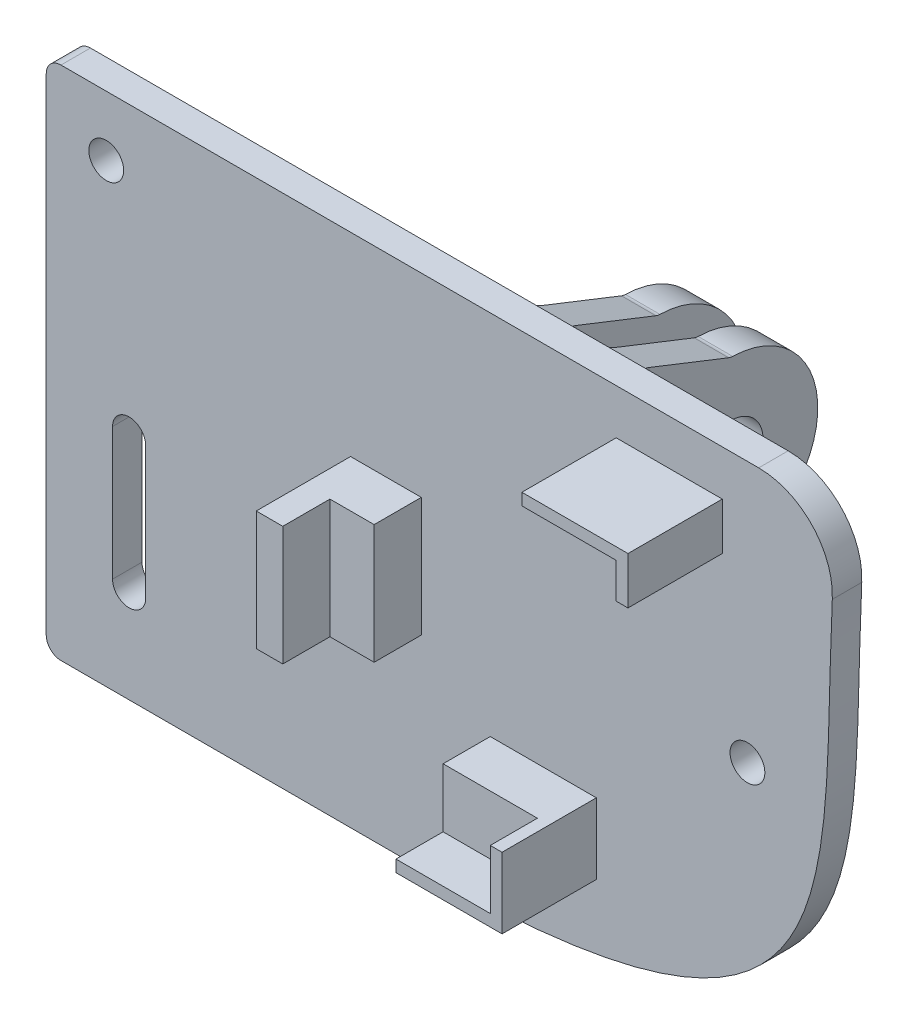
from build123d import *

# Parameters (mm, degrees)
BOSS_EXTRUDE1_DEPTH = 2.54
SKETCH8_R           = 2.794
BOSS_EXTRUDE5_DEPTH = 1.4859
SKETCH9_R           = 2.794
BOSS_EXTRUDE6_DEPTH = 1.4859
FILLET1_R           = 6.35
FILLET2_R           = 1.27
SKETCH11_R          = 1.5
CUT_EXTRUDE1_DEPTH  = 104.464232939
CUT_EXTRUDE3_DEPTH  = 104.464232939
SKETCH14_W          = 9.144
SKETCH14_H          = 6.096
SKETCH14_W_2        = 6.096
SKETCH14_H_2        = 10.277436068
SKETCH14_H_3        = 4.064
BOSS_EXTRUDE7_DEPTH = 4.064
SKETCH15_W          = 2.286
SKETCH15_H          = 10.277436068
BOSS_EXTRUDE8_DEPTH = 4.064
FILLET3_R           = 1


with BuildPart() as part:
    # Sketch3 → Boss-Extrude1 (new body)
    with BuildSketch(Plane(origin=(0, 0, 48.176932074), x_dir=(-1, 0, 0), z_dir=(0, 0, -1))):
        with BuildLine():
            Line((-5.330605085, -70.964477634), (-5.330605085, -26.514477634))
            Line((-5.330605085, -26.514477634), (-73.555005085, -26.514477634))
            add(Edge.make_bspline(
                [(-37.080605085, -70.964477634), (-79.637463047, -70.964477634), (-70.893021391, -52.676234808), (-73.555005085, -26.514477634)],
                knots=[0, 0, 0, 0, 1, 1, 1, 1], degree=3))
            Line((-37.080605085, -70.964477634), (-5.330605085, -70.964477634))
        make_face()
    extrude(amount=BOSS_EXTRUDE1_DEPTH)

    # Sketch8 → Boss-Extrude5 (add, symmetric)
    with BuildSketch(Plane.ZY.offset(-45.970605085)):
        with BuildLine():
            Line((45.636932074, -45.088449611), (45.636932074, -30.077049611))
            Line((45.636932074, -30.077049611), (45.636932074, -26.902049611))
            Line((45.636932074, -26.902049611), (37.585132074, -30.077049611))
            ThreePointArc((37.585132074, -30.077049611), (30.079432074, -37.582749611), (37.585132074, -45.088449611))
            Line((37.585132074, -45.088449611), (45.636932074, -48.263449611))
            Line((45.636932074, -48.263449611), (45.636932074, -45.088449611))
        make_face()
        with Locations((37.585132074, -37.582749611)):
            Circle(SKETCH8_R, mode=Mode.SUBTRACT)
    extrude(amount=BOSS_EXTRUDE5_DEPTH, both=True)

    # Sketch9 → Boss-Extrude6 (add, symmetric)
    with BuildSketch(Plane.ZY.offset(-52.244405085)):
        with BuildLine():
            Line((37.585132074, -30.077049611), (45.636932074, -26.902049611))
            Line((45.636932074, -26.902049611), (45.636932074, -30.077049611))
            Line((45.636932074, -30.077049611), (45.636932074, -45.088449611))
            Line((45.636932074, -45.088449611), (45.636932074, -48.263449611))
            Line((45.636932074, -48.263449611), (37.585132074, -45.088449611))
            ThreePointArc((37.585132074, -45.088449611), (30.079432074, -37.582749611), (37.585132074, -30.077049611))
        make_face()
        with Locations((37.585132074, -37.582749611)):
            Circle(SKETCH9_R, mode=Mode.SUBTRACT)
    extrude(amount=BOSS_EXTRUDE6_DEPTH, both=True)

    # Fillet1
    fillet1_edges = [part.edges().sort_by_distance(p)[0] for p in [
        (73.555005085, -26.514477634, 46.906932074),
    ]]
    fillet(fillet1_edges, radius=FILLET1_R)

    # Fillet2
    fillet2_edges = [part.edges().sort_by_distance(p)[0] for p in [
        (5.330605085, -26.514477634, 46.906932074),
        (5.330605085, -70.964477634, 46.906932074),
    ]]
    fillet(fillet2_edges, radius=FILLET2_R)

    # Sketch11 → Cut-Extrude1 (cut, through all)
    with BuildSketch(Plane.XY.offset(48.176932074)):
        with Locations((10.501991532, -31.685864082)):
            Circle(SKETCH11_R)
        with Locations((65.764167989, -49.003253007)):
            Circle(SKETCH11_R)
    extrude(amount=-CUT_EXTRUDE1_DEPTH, mode=Mode.SUBTRACT)

    # Sketch13 → Cut-Extrude3 (cut, through all)
    with BuildSketch(Plane.XY.offset(48.176932074)):
        with BuildLine():
            Line((11.045605085, -62.666787944), (11.045605085, -51.271162116))
            ThreePointArc((11.045605085, -51.271162116), (12.473581383, -49.843185817), (13.901557682, -51.271162116))
            Line((13.901557682, -51.271162116), (13.901557682, -62.666787944))
            ThreePointArc((13.901557682, -62.666787944), (12.473581383, -64.094764243), (11.045605085, -62.666787944))
        make_face()
    extrude(amount=-CUT_EXTRUDE3_DEPTH, mode=Mode.SUBTRACT)

    # Sketch14 → Boss-Extrude7 (add)
    with BuildSketch(Plane.XY.offset(48.176932074)):
        with Locations((48.170658264, -61.185477634)):
            Rectangle(SKETCH14_W, SKETCH14_H)
        with Locations((34.607686971, -48.396046186)):
            Rectangle(SKETCH14_W_2, SKETCH14_H_2)
        with Locations((59.024762651, -32.446016036)):
            Rectangle(SKETCH14_W, SKETCH14_H_3)
    extrude(amount=BOSS_EXTRUDE7_DEPTH)

    # Sketch15 → Boss-Extrude8 (add)
    with BuildSketch(Plane.XY.offset(52.240932074)):
        with Locations((32.702686971, -48.396046186)):
            Rectangle(SKETCH15_W, SKETCH15_H)
        Polygon((54.452762651, -30.414016036), (54.452762651, -31.430016036), (62.580762651, -31.430016036), (62.580762651, -34.478016036), (63.596762651, -34.478016036), (63.596762651, -30.414016036), align=None)
        Polygon((43.598658264, -63.217477634), (51.726658264, -63.217477634), (51.726658264, -58.137477634), (52.742658264, -58.137477634), (52.742658264, -64.233477634), (43.598658264, -64.233477634), align=None)
    extrude(amount=BOSS_EXTRUDE8_DEPTH)

    # Fillet3
    # the kernel refuses this fillet: 1 mm, written as the material it adds along each edge
    with BuildSketch(Plane(origin=(44.484705085, -24.402049611, 45.636932074), x_dir=(-1, 0, 0), z_dir=(0, -1, 0))) as fillet3_piece_1_section:
        with BuildLine():
            CenterArc((FILLET3_R, FILLET3_R), FILLET3_R, 180, 90)
            Line((0, FILLET3_R), (-FILLET3_R * 0.02, FILLET3_R))
            Line((-FILLET3_R * 0.02, FILLET3_R), (-FILLET3_R * 0.02, -FILLET3_R * 0.02))
            Line((-FILLET3_R * 0.02, -FILLET3_R * 0.02), (FILLET3_R, -FILLET3_R * 0.02))
            Line((FILLET3_R, -FILLET3_R * 0.02), (FILLET3_R, 0))
        make_face()
    fillet3_piece_1 = extrude(amount=26.3614, mode=Mode.PRIVATE)
    fillet3_piece_1 = split(fillet3_piece_1, bisect_by=Plane(origin=(44.257287749, -28.415977986, 41.797609716), z_dir=(0, -0.9302870363838799, 0.36683242759616796)), keep=Keep.TOP, mode=Mode.PRIVATE)
    fillet3_piece_1 = split(fillet3_piece_1, bisect_by=Plane(origin=(44.257287749, -46.749521237, 41.797609716), z_dir=(0, 0.9302870363838802, 0.36683242759616724)), keep=Keep.TOP, mode=Mode.PRIVATE)
    add(fillet3_piece_1)
    with BuildSketch(Plane(origin=(47.456505085, -30.077049611, 37.585132074), x_dir=(0, -0.011507965676518926, -0.9999337811705274), z_dir=(-1, 0, 0)), Plane(origin=(44.484705085, -45.088449611, 37.585132074), x_dir=(0, 0.011507965676519873, -0.9999337811705273), z_dir=(1, 0, 0)), Plane(origin=(53.730305085, -30.077049611, 37.585132074), x_dir=(0, -0.011507965676498363, -0.9999337811705276), z_dir=(-1, 0, 0))) as fillet3_piece_2:
        with BuildLine():
            CenterArc((0.184258642, -0.999933781), FILLET3_R, 90.659372418, 20.20165218)
            Line((-0.171843783, -0.065486852), (-0.178965832, -0.046797914))
            Line((-0.178965832, -0.046797914), (-0.007122049, 0.018688939))
            Line((-0.007122049, 0.018688939), (0.000230159, 0.019998676))
            ThreePointArc((0.000230159, 0.019998676), (0.086375338, 0.019502981), (0.172520517, 0.019998676))
            Line((0.172520517, 0.019998676), (0.172750676, 0))
        make_face()
    extrude(amount=2.9718)
    with BuildSketch(Plane(origin=(47.456505085, -50.763449611, 45.636932074), x_dir=(1, 0, 0), z_dir=(0, 1, 0))) as fillet3_piece_3_section:
        with BuildLine():
            CenterArc((FILLET3_R, FILLET3_R), FILLET3_R, 180, 90)
            Line((0, FILLET3_R), (-FILLET3_R * 0.02, FILLET3_R))
            Line((-FILLET3_R * 0.02, FILLET3_R), (-FILLET3_R * 0.02, -FILLET3_R * 0.02))
            Line((-FILLET3_R * 0.02, -FILLET3_R * 0.02), (FILLET3_R, -FILLET3_R * 0.02))
            Line((FILLET3_R, -FILLET3_R * 0.02), (FILLET3_R, 0))
        make_face()
    fillet3_piece_3 = extrude(amount=26.3614, mode=Mode.PRIVATE)
    fillet3_piece_3 = split(fillet3_piece_3, bisect_by=Plane(origin=(47.68392242, -28.415977986, 41.797609716), z_dir=(0, -0.9302870363838799, 0.36683242759616796)), keep=Keep.TOP, mode=Mode.PRIVATE)
    fillet3_piece_3 = split(fillet3_piece_3, bisect_by=Plane(origin=(47.68392242, -46.749521237, 41.797609716), z_dir=(0, 0.9302870363838802, 0.36683242759616724)), keep=Keep.TOP, mode=Mode.PRIVATE)
    add(fillet3_piece_3)
    with BuildSketch(Plane(origin=(44.484705085, -48.263449611, 45.636932074), x_dir=(0, -1, 0), z_dir=(1, 0, 0)), Plane(origin=(50.758505085, -48.263449611, 45.636932074), x_dir=(0, -1, 0), z_dir=(1, 0, 0))) as fillet3_piece_4:
        with BuildLine():
            CenterArc((FILLET3_R * 0.680615280704, FILLET3_R), FILLET3_R, 201.520397017, 68.479602983)
            Line((-FILLET3_R * 0.24967175568, FILLET3_R * 0.633167572404), (-FILLET3_R * 0.268277496407, FILLET3_R * 0.625830923852))
            Line((-FILLET3_R * 0.268277496407, FILLET3_R * 0.625830923852), (-FILLET3_R * 0.0136123056141, -FILLET3_R * 0.02))
            Line((-FILLET3_R * 0.0136123056141, -FILLET3_R * 0.02), (FILLET3_R * 0.680615280704, -FILLET3_R * 0.02))
            Line((FILLET3_R * 0.680615280704, -FILLET3_R * 0.02), (FILLET3_R * 0.680615280704, 0))
        make_face()
    extrude(amount=2.9718)
    with BuildSketch(Plane(origin=(47.456505085, -26.902049611, 45.636932074), x_dir=(0, 1, 0), z_dir=(-1, 0, 0))) as fillet3_piece_5:
        with BuildLine():
            CenterArc((0.700407326, 0.949807372), FILLET3_R, 201.520397017, 50.249417843)
            Line((-0.22987971, 0.582974945), (-0.248485451, 0.575638296))
            Line((-0.248485451, 0.575638296), (-0.018605741, -0.007336649))
            Line((-0.018605741, -0.007336649), (0, -0.02))
            ThreePointArc((0, -0.02), (0.193785989, -0.02), (0.38131527, -0.018996147))
            Line((0.38131527, -0.018996147), (0.387571977, 0))
        make_face()
    extrude(amount=2.9718)
    with BuildSketch(Plane(origin=(50.758505085, -24.402049611, 45.636932074), x_dir=(-1, 0, 0), z_dir=(0, -1, 0))) as fillet3_piece_6_section:
        with BuildLine():
            CenterArc((FILLET3_R, FILLET3_R), FILLET3_R, 180, 90)
            Line((0, FILLET3_R), (-FILLET3_R * 0.02, FILLET3_R))
            Line((-FILLET3_R * 0.02, FILLET3_R), (-FILLET3_R * 0.02, -FILLET3_R * 0.02))
            Line((-FILLET3_R * 0.02, -FILLET3_R * 0.02), (FILLET3_R, -FILLET3_R * 0.02))
            Line((FILLET3_R, -FILLET3_R * 0.02), (FILLET3_R, 0))
        make_face()
    fillet3_piece_6 = extrude(amount=26.3614, mode=Mode.PRIVATE)
    fillet3_piece_6 = split(fillet3_piece_6, bisect_by=Plane(origin=(50.531087749, -46.749521237, 41.797609716), z_dir=(0, 0.9302870363838802, 0.36683242759616724)), keep=Keep.TOP, mode=Mode.PRIVATE)
    fillet3_piece_6 = split(fillet3_piece_6, bisect_by=Plane(origin=(50.531087749, -28.415977986, 41.797609716), z_dir=(0, -0.9302870363838799, 0.36683242759616835)), keep=Keep.TOP, mode=Mode.PRIVATE)
    add(fillet3_piece_6)
    with BuildSketch(Plane(origin=(50.758505085, -26.902049611, 45.636932074), x_dir=(0, 1, 0), z_dir=(1, 0, 0))) as fillet3_piece_7:
        with BuildLine():
            CenterArc((0.700407326, -0.949807372), FILLET3_R, 108.23018514, 50.249417843)
            Line((-0.22987971, -0.582974945), (-0.248485451, -0.575638296))
            Line((-0.248485451, -0.575638296), (-0.018605741, 0.007336649))
            Line((-0.018605741, 0.007336649), (0, 0.02))
            ThreePointArc((0, 0.02), (0.193785989, 0.02), (0.38131527, 0.018996147))
            Line((0.38131527, 0.018996147), (0.387571977, 0))
        make_face()
    extrude(amount=2.9718)
    with BuildSketch(Plane(origin=(53.730305085, -45.088449611, 37.585132074), x_dir=(0, -0.3668324275961554, 0.9302870363838848), z_dir=(-1, 0, 0))) as fillet3_piece_8:
        with BuildLine():
            CenterArc((0.183898923, -1), FILLET3_R, 90, 20.20165218)
            Line((-0.161426339, -0.061516935), (-0.168332844, -0.042747273))
            ThreePointArc((-0.168332844, -0.042747273), (-0.087658228, -0.012533966), (-0.007336649, 0.018605741))
            Line((-0.007336649, 0.018605741), (0, 0.02))
            Line((0, 0.02), (0.183898923, 0.02))
            Line((0.183898923, 0.02), (0.183898923, 0))
        make_face()
    extrude(amount=2.9718)
    with BuildSketch(Plane(origin=(53.730305085, -50.763449611, 45.636932074), x_dir=(1, 0, 0), z_dir=(0, 1, 0))) as fillet3_piece_9_section:
        with BuildLine():
            CenterArc((FILLET3_R, FILLET3_R), FILLET3_R, 180, 90)
            Line((0, FILLET3_R), (-FILLET3_R * 0.02, FILLET3_R))
            Line((-FILLET3_R * 0.02, FILLET3_R), (-FILLET3_R * 0.02, -FILLET3_R * 0.02))
            Line((-FILLET3_R * 0.02, -FILLET3_R * 0.02), (FILLET3_R, -FILLET3_R * 0.02))
            Line((FILLET3_R, -FILLET3_R * 0.02), (FILLET3_R, 0))
        make_face()
    fillet3_piece_9 = extrude(amount=26.3614, mode=Mode.PRIVATE)
    fillet3_piece_9 = split(fillet3_piece_9, bisect_by=Plane(origin=(53.95772242, -46.749521237, 41.797609716), z_dir=(0, 0.9302870363838802, 0.36683242759616724)), keep=Keep.TOP, mode=Mode.PRIVATE)
    fillet3_piece_9 = split(fillet3_piece_9, bisect_by=Plane(origin=(53.95772242, -28.415977986, 41.797609716), z_dir=(0, -0.9302870363838799, 0.36683242759616835)), keep=Keep.TOP, mode=Mode.PRIVATE)
    add(fillet3_piece_9)
    with BuildSketch(Plane(origin=(47.456505085, -26.902049611, 45.636932074), x_dir=(0, 1, 0), z_dir=(-1, 0, 0))) as fillet3_piece_10a_section:
        with BuildLine():
            CenterArc((0.700407326, 0.949807372), FILLET3_R, 201.520397017, 50.249417843)
            Line((-0.22987971, 0.582974945), (-0.248485451, 0.575638296))
            Line((-0.248485451, 0.575638296), (-0.018605741, -0.007336649))
            Line((-0.018605741, -0.007336649), (0, -0.02))
            ThreePointArc((0, -0.02), (0.193785989, -0.02), (0.38131527, -0.018996147))
            Line((0.38131527, -0.018996147), (0.387571977, 0))
        make_face()
    fillet3_piece_10a = extrude(amount=4.538453414, mode=Mode.PRIVATE)
    fillet3_piece_10a = split(fillet3_piece_10a, bisect_by=Plane(origin=(44.484705085, -26.864445024, 45.495418853), z_dir=(-1, 0, 0)), keep=Keep.TOP, mode=Mode.PRIVATE)
    with BuildSketch(Plane(origin=(44.484705085, -24.402049611, 45.636932074), x_dir=(-1, 0, 0), z_dir=(0, -1, 0))) as fillet3_piece_10b_section:
        with BuildLine():
            CenterArc((FILLET3_R, FILLET3_R), FILLET3_R, 180, 90)
            Line((0, FILLET3_R), (-FILLET3_R * 0.02, FILLET3_R))
            Line((-FILLET3_R * 0.02, FILLET3_R), (-FILLET3_R * 0.02, -FILLET3_R * 0.02))
            Line((-FILLET3_R * 0.02, -FILLET3_R * 0.02), (FILLET3_R, -FILLET3_R * 0.02))
            Line((FILLET3_R, -FILLET3_R * 0.02), (FILLET3_R, 0))
        make_face()
    fillet3_piece_10b = extrude(amount=26.3614, mode=Mode.PRIVATE)
    fillet3_piece_10b = split(fillet3_piece_10b, bisect_by=Plane(origin=(44.281015021, -26.514477634, 45.372103573), z_dir=(0, -1, 0)), keep=Keep.TOP, mode=Mode.PRIVATE)
    fillet3_piece_10b = split(fillet3_piece_10b, bisect_by=Plane(origin=(44.281015021, -26.973374036, 45.456053333), z_dir=(0, 0.9302870363838799, -0.36683242759616796)), keep=Keep.TOP, mode=Mode.PRIVATE)
    fillet3_piece_10 = fillet3_piece_10a & fillet3_piece_10b
    add(fillet3_piece_10)
    with BuildSketch(Plane(origin=(42.783166883, -48.263449611, 45.636932074), x_dir=(0, -1, 0), z_dir=(1, 0, 0))) as fillet3_piece_11a_section:
        with BuildLine():
            CenterArc((FILLET3_R * 0.680615280704, FILLET3_R), FILLET3_R, 201.520397017, 68.479602983)
            Line((-FILLET3_R * 0.24967175568, FILLET3_R * 0.633167572404), (-FILLET3_R * 0.268277496407, FILLET3_R * 0.625830923852))
            Line((-FILLET3_R * 0.268277496407, FILLET3_R * 0.625830923852), (-FILLET3_R * 0.0136123056141, -FILLET3_R * 0.02))
            Line((-FILLET3_R * 0.0136123056141, -FILLET3_R * 0.02), (FILLET3_R * 0.680615280704, -FILLET3_R * 0.02))
            Line((FILLET3_R * 0.680615280704, -FILLET3_R * 0.02), (FILLET3_R * 0.680615280704, 0))
        make_face()
    fillet3_piece_11a = extrude(amount=4.673338202, mode=Mode.PRIVATE)
    fillet3_piece_11a = split(fillet3_piece_11a, bisect_by=Plane(origin=(44.484705085, -48.357764725, 45.498358762), z_dir=(-1, 0, 0)), keep=Keep.TOP, mode=Mode.PRIVATE)
    with BuildSketch(Plane(origin=(44.484705085, -24.402049611, 45.636932074), x_dir=(-1, 0, 0), z_dir=(0, -1, 0))) as fillet3_piece_11b_section:
        with BuildLine():
            CenterArc((FILLET3_R, FILLET3_R), FILLET3_R, 180, 90)
            Line((0, FILLET3_R), (-FILLET3_R * 0.02, FILLET3_R))
            Line((-FILLET3_R * 0.02, FILLET3_R), (-FILLET3_R * 0.02, -FILLET3_R * 0.02))
            Line((-FILLET3_R * 0.02, -FILLET3_R * 0.02), (FILLET3_R, -FILLET3_R * 0.02))
            Line((FILLET3_R, -FILLET3_R * 0.02), (FILLET3_R, 0))
        make_face()
    fillet3_piece_11b = extrude(amount=26.3614, mode=Mode.PRIVATE)
    fillet3_piece_11b = split(fillet3_piece_11b, bisect_by=Plane(origin=(44.262491368, -48.345787947, 45.845742093), z_dir=(0, -0.9302870363838802, -0.36683242759616724)), keep=Keep.TOP, mode=Mode.PRIVATE)
    fillet3_piece_11 = fillet3_piece_11a & fillet3_piece_11b
    add(fillet3_piece_11)
    with BuildSketch(Plane(origin=(47.456505085, -50.763449611, 45.636932074), x_dir=(1, 0, 0), z_dir=(0, 1, 0))) as fillet3_piece_12a_section:
        with BuildLine():
            CenterArc((FILLET3_R, FILLET3_R), FILLET3_R, 180, 90)
            Line((0, FILLET3_R), (-FILLET3_R * 0.02, FILLET3_R))
            Line((-FILLET3_R * 0.02, FILLET3_R), (-FILLET3_R * 0.02, -FILLET3_R * 0.02))
            Line((-FILLET3_R * 0.02, -FILLET3_R * 0.02), (FILLET3_R, -FILLET3_R * 0.02))
            Line((FILLET3_R, -FILLET3_R * 0.02), (FILLET3_R, 0))
        make_face()
    fillet3_piece_12a = extrude(amount=26.3614, mode=Mode.PRIVATE)
    fillet3_piece_12a = split(fillet3_piece_12a, bisect_by=Plane(origin=(47.678718801, -48.345787947, 45.845742093), z_dir=(0, -0.9302870363838802, -0.36683242759616724)), keep=Keep.TOP, mode=Mode.PRIVATE)
    with BuildSketch(Plane(origin=(44.484705085, -48.263449611, 45.636932074), x_dir=(0, -1, 0), z_dir=(1, 0, 0))) as fillet3_piece_12b_section:
        with BuildLine():
            CenterArc((FILLET3_R * 0.680615280704, FILLET3_R), FILLET3_R, 201.520397017, 68.479602983)
            Line((-FILLET3_R * 0.24967175568, FILLET3_R * 0.633167572404), (-FILLET3_R * 0.268277496407, FILLET3_R * 0.625830923852))
            Line((-FILLET3_R * 0.268277496407, FILLET3_R * 0.625830923852), (-FILLET3_R * 0.0136123056141, -FILLET3_R * 0.02))
            Line((-FILLET3_R * 0.0136123056141, -FILLET3_R * 0.02), (FILLET3_R * 0.680615280704, -FILLET3_R * 0.02))
            Line((FILLET3_R * 0.680615280704, -FILLET3_R * 0.02), (FILLET3_R * 0.680615280704, 0))
        make_face()
    fillet3_piece_12b = extrude(amount=4.673338202, mode=Mode.PRIVATE)
    fillet3_piece_12b = split(fillet3_piece_12b, bisect_by=Plane(origin=(47.456505085, -48.357764725, 45.498358762), z_dir=(1, 0, 0)), keep=Keep.TOP, mode=Mode.PRIVATE)
    fillet3_piece_12 = fillet3_piece_12a & fillet3_piece_12b
    add(fillet3_piece_12)
    with BuildSketch(Plane(origin=(47.456505085, -50.763449611, 45.636932074), x_dir=(1, 0, 0), z_dir=(0, 1, 0))) as fillet3_piece_13a_section:
        with BuildLine():
            CenterArc((FILLET3_R, FILLET3_R), FILLET3_R, 180, 90)
            Line((0, FILLET3_R), (-FILLET3_R * 0.02, FILLET3_R))
            Line((-FILLET3_R * 0.02, FILLET3_R), (-FILLET3_R * 0.02, -FILLET3_R * 0.02))
            Line((-FILLET3_R * 0.02, -FILLET3_R * 0.02), (FILLET3_R, -FILLET3_R * 0.02))
            Line((FILLET3_R, -FILLET3_R * 0.02), (FILLET3_R, 0))
        make_face()
    fillet3_piece_13a = extrude(amount=26.3614, mode=Mode.PRIVATE)
    fillet3_piece_13a = split(fillet3_piece_13a, bisect_by=Plane(origin=(47.660195148, -26.514477634, 45.372103573), z_dir=(0, -1, 0)), keep=Keep.TOP, mode=Mode.PRIVATE)
    fillet3_piece_13a = split(fillet3_piece_13a, bisect_by=Plane(origin=(47.660195148, -26.973374036, 45.456053333), z_dir=(0, 0.9302870363838799, -0.36683242759616796)), keep=Keep.TOP, mode=Mode.PRIVATE)
    with BuildSketch(Plane(origin=(49.023158499, -26.902049611, 45.636932074), x_dir=(0, 1, 0), z_dir=(-1, 0, 0))) as fillet3_piece_13b_section:
        with BuildLine():
            CenterArc((0.700407326, 0.949807372), FILLET3_R, 201.520397017, 50.249417843)
            Line((-0.22987971, 0.582974945), (-0.248485451, 0.575638296))
            Line((-0.248485451, 0.575638296), (-0.018605741, -0.007336649))
            Line((-0.018605741, -0.007336649), (0, -0.02))
            ThreePointArc((0, -0.02), (0.193785989, -0.02), (0.38131527, -0.018996147))
            Line((0.38131527, -0.018996147), (0.387571977, 0))
        make_face()
    fillet3_piece_13b = extrude(amount=4.538453414, mode=Mode.PRIVATE)
    fillet3_piece_13b = split(fillet3_piece_13b, bisect_by=Plane(origin=(47.456505085, -26.864445024, 45.495418853), z_dir=(1, 0, 0)), keep=Keep.TOP, mode=Mode.PRIVATE)
    fillet3_piece_13 = fillet3_piece_13a & fillet3_piece_13b
    add(fillet3_piece_13)
    with BuildSketch(Plane(origin=(49.19185167, -26.902049611, 45.636932074), x_dir=(0, 1, 0), z_dir=(1, 0, 0))) as fillet3_piece_14a_section:
        with BuildLine():
            CenterArc((0.700407326, -0.949807372), FILLET3_R, 108.23018514, 50.249417843)
            Line((-0.22987971, -0.582974945), (-0.248485451, -0.575638296))
            Line((-0.248485451, -0.575638296), (-0.018605741, 0.007336649))
            Line((-0.018605741, 0.007336649), (0, 0.02))
            ThreePointArc((0, 0.02), (0.193785989, 0.02), (0.38131527, 0.018996147))
            Line((0.38131527, 0.018996147), (0.387571977, 0))
        make_face()
    fillet3_piece_14a = extrude(amount=4.538453414, mode=Mode.PRIVATE)
    fillet3_piece_14a = split(fillet3_piece_14a, bisect_by=Plane(origin=(50.758505085, -26.864445024, 45.495418853), z_dir=(-1, 0, 0)), keep=Keep.TOP, mode=Mode.PRIVATE)
    with BuildSketch(Plane(origin=(50.758505085, -24.402049611, 45.636932074), x_dir=(-1, 0, 0), z_dir=(0, -1, 0))) as fillet3_piece_14b_section:
        with BuildLine():
            CenterArc((FILLET3_R, FILLET3_R), FILLET3_R, 180, 90)
            Line((0, FILLET3_R), (-FILLET3_R * 0.02, FILLET3_R))
            Line((-FILLET3_R * 0.02, FILLET3_R), (-FILLET3_R * 0.02, -FILLET3_R * 0.02))
            Line((-FILLET3_R * 0.02, -FILLET3_R * 0.02), (FILLET3_R, -FILLET3_R * 0.02))
            Line((FILLET3_R, -FILLET3_R * 0.02), (FILLET3_R, 0))
        make_face()
    fillet3_piece_14b = extrude(amount=26.3614, mode=Mode.PRIVATE)
    fillet3_piece_14b = split(fillet3_piece_14b, bisect_by=Plane(origin=(50.554815021, -26.514477634, 45.372103573), z_dir=(0, -1, 0)), keep=Keep.TOP, mode=Mode.PRIVATE)
    fillet3_piece_14b = split(fillet3_piece_14b, bisect_by=Plane(origin=(50.554815021, -26.973374036, 45.456053333), z_dir=(0, 0.9302870363838799, -0.36683242759616835)), keep=Keep.TOP, mode=Mode.PRIVATE)
    fillet3_piece_14 = fillet3_piece_14a & fillet3_piece_14b
    add(fillet3_piece_14)
    with BuildSketch(Plane(origin=(50.758505085, -24.402049611, 45.636932074), x_dir=(-1, 0, 0), z_dir=(0, -1, 0))) as fillet3_piece_15a_section:
        with BuildLine():
            CenterArc((FILLET3_R, FILLET3_R), FILLET3_R, 180, 90)
            Line((0, FILLET3_R), (-FILLET3_R * 0.02, FILLET3_R))
            Line((-FILLET3_R * 0.02, FILLET3_R), (-FILLET3_R * 0.02, -FILLET3_R * 0.02))
            Line((-FILLET3_R * 0.02, -FILLET3_R * 0.02), (FILLET3_R, -FILLET3_R * 0.02))
            Line((FILLET3_R, -FILLET3_R * 0.02), (FILLET3_R, 0))
        make_face()
    fillet3_piece_15a = extrude(amount=26.3614, mode=Mode.PRIVATE)
    fillet3_piece_15a = split(fillet3_piece_15a, bisect_by=Plane(origin=(50.536291368, -48.345787947, 45.845742093), z_dir=(0, -0.9302870363838802, -0.36683242759616724)), keep=Keep.TOP, mode=Mode.PRIVATE)
    with BuildSketch(Plane(origin=(49.056966883, -48.263449611, 45.636932074), x_dir=(0, -1, 0), z_dir=(1, 0, 0))) as fillet3_piece_15b_section:
        with BuildLine():
            CenterArc((FILLET3_R * 0.680615280704, FILLET3_R), FILLET3_R, 201.520397017, 68.479602983)
            Line((-FILLET3_R * 0.24967175568, FILLET3_R * 0.633167572404), (-FILLET3_R * 0.268277496407, FILLET3_R * 0.625830923852))
            Line((-FILLET3_R * 0.268277496407, FILLET3_R * 0.625830923852), (-FILLET3_R * 0.0136123056141, -FILLET3_R * 0.02))
            Line((-FILLET3_R * 0.0136123056141, -FILLET3_R * 0.02), (FILLET3_R * 0.680615280704, -FILLET3_R * 0.02))
            Line((FILLET3_R * 0.680615280704, -FILLET3_R * 0.02), (FILLET3_R * 0.680615280704, 0))
        make_face()
    fillet3_piece_15b = extrude(amount=4.673338202, mode=Mode.PRIVATE)
    fillet3_piece_15b = split(fillet3_piece_15b, bisect_by=Plane(origin=(50.758505085, -48.357764725, 45.498358762), z_dir=(-1, 0, 0)), keep=Keep.TOP, mode=Mode.PRIVATE)
    fillet3_piece_15 = fillet3_piece_15a & fillet3_piece_15b
    add(fillet3_piece_15)
    with BuildSketch(Plane(origin=(50.758505085, -26.902049611, 45.636932074), x_dir=(0, 1, 0), z_dir=(1, 0, 0))) as fillet3_piece_16a_section:
        with BuildLine():
            CenterArc((0.700407326, -0.949807372), FILLET3_R, 108.23018514, 50.249417843)
            Line((-0.22987971, -0.582974945), (-0.248485451, -0.575638296))
            Line((-0.248485451, -0.575638296), (-0.018605741, 0.007336649))
            Line((-0.018605741, 0.007336649), (0, 0.02))
            ThreePointArc((0, 0.02), (0.193785989, 0.02), (0.38131527, 0.018996147))
            Line((0.38131527, 0.018996147), (0.387571977, 0))
        make_face()
    fillet3_piece_16a = extrude(amount=4.538453414, mode=Mode.PRIVATE)
    fillet3_piece_16a = split(fillet3_piece_16a, bisect_by=Plane(origin=(53.730305085, -26.864445024, 45.495418853), z_dir=(1, 0, 0)), keep=Keep.TOP, mode=Mode.PRIVATE)
    with BuildSketch(Plane(origin=(53.730305085, -50.763449611, 45.636932074), x_dir=(1, 0, 0), z_dir=(0, 1, 0))) as fillet3_piece_16b_section:
        with BuildLine():
            CenterArc((FILLET3_R, FILLET3_R), FILLET3_R, 180, 90)
            Line((0, FILLET3_R), (-FILLET3_R * 0.02, FILLET3_R))
            Line((-FILLET3_R * 0.02, FILLET3_R), (-FILLET3_R * 0.02, -FILLET3_R * 0.02))
            Line((-FILLET3_R * 0.02, -FILLET3_R * 0.02), (FILLET3_R, -FILLET3_R * 0.02))
            Line((FILLET3_R, -FILLET3_R * 0.02), (FILLET3_R, 0))
        make_face()
    fillet3_piece_16b = extrude(amount=26.3614, mode=Mode.PRIVATE)
    fillet3_piece_16b = split(fillet3_piece_16b, bisect_by=Plane(origin=(53.933995148, -26.514477634, 45.372103573), z_dir=(0, -1, 0)), keep=Keep.TOP, mode=Mode.PRIVATE)
    fillet3_piece_16b = split(fillet3_piece_16b, bisect_by=Plane(origin=(53.933995148, -26.973374036, 45.456053333), z_dir=(0, 0.9302870363838799, -0.36683242759616835)), keep=Keep.TOP, mode=Mode.PRIVATE)
    fillet3_piece_16 = fillet3_piece_16a & fillet3_piece_16b
    add(fillet3_piece_16)
    with BuildSketch(Plane(origin=(53.730305085, -50.763449611, 45.636932074), x_dir=(1, 0, 0), z_dir=(0, 1, 0))) as fillet3_piece_17a_section:
        with BuildLine():
            CenterArc((FILLET3_R, FILLET3_R), FILLET3_R, 180, 90)
            Line((0, FILLET3_R), (-FILLET3_R * 0.02, FILLET3_R))
            Line((-FILLET3_R * 0.02, FILLET3_R), (-FILLET3_R * 0.02, -FILLET3_R * 0.02))
            Line((-FILLET3_R * 0.02, -FILLET3_R * 0.02), (FILLET3_R, -FILLET3_R * 0.02))
            Line((FILLET3_R, -FILLET3_R * 0.02), (FILLET3_R, 0))
        make_face()
    fillet3_piece_17a = extrude(amount=26.3614, mode=Mode.PRIVATE)
    fillet3_piece_17a = split(fillet3_piece_17a, bisect_by=Plane(origin=(53.952518801, -48.345787947, 45.845742093), z_dir=(0, -0.9302870363838802, -0.36683242759616724)), keep=Keep.TOP, mode=Mode.PRIVATE)
    with BuildSketch(Plane(origin=(50.758505085, -48.263449611, 45.636932074), x_dir=(0, -1, 0), z_dir=(1, 0, 0))) as fillet3_piece_17b_section:
        with BuildLine():
            CenterArc((FILLET3_R * 0.680615280704, FILLET3_R), FILLET3_R, 201.520397017, 68.479602983)
            Line((-FILLET3_R * 0.24967175568, FILLET3_R * 0.633167572404), (-FILLET3_R * 0.268277496407, FILLET3_R * 0.625830923852))
            Line((-FILLET3_R * 0.268277496407, FILLET3_R * 0.625830923852), (-FILLET3_R * 0.0136123056141, -FILLET3_R * 0.02))
            Line((-FILLET3_R * 0.0136123056141, -FILLET3_R * 0.02), (FILLET3_R * 0.680615280704, -FILLET3_R * 0.02))
            Line((FILLET3_R * 0.680615280704, -FILLET3_R * 0.02), (FILLET3_R * 0.680615280704, 0))
        make_face()
    fillet3_piece_17b = extrude(amount=4.673338202, mode=Mode.PRIVATE)
    fillet3_piece_17b = split(fillet3_piece_17b, bisect_by=Plane(origin=(53.730305085, -48.357764725, 45.498358762), z_dir=(1, 0, 0)), keep=Keep.TOP, mode=Mode.PRIVATE)
    fillet3_piece_17 = fillet3_piece_17a & fillet3_piece_17b
    add(fillet3_piece_17)


solid = part.part
